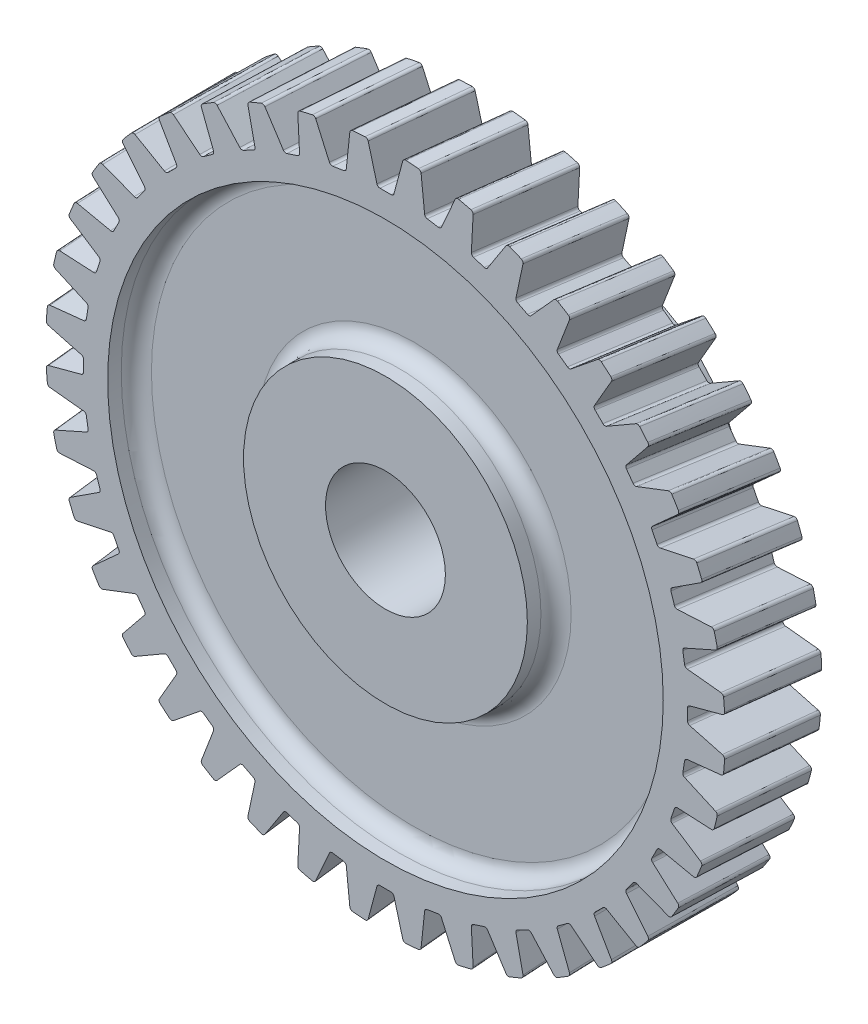
from build123d import *

# Parameters (mm, degrees)
FILLET1_R         = 1
CIRPATTERN1_COUNT = 40
FILLET2_R         = 0.2


with BuildPart() as part:
    # Sketch2 → Revolve1 (revolve)
    with BuildSketch(Plane(origin=(0, 0, 0), x_dir=(0, 0, -1), z_dir=(1, 0, 0))):
        Polygon((11, 3.96875), (-3.2, 3.96875), (-3.2, 9.4), (-1.3, 9.4), (-1.3, 18.4), (-3.2, 18.4), (-3.2, 22.5), (3.2, 22.5), (3.2, 18.4), (1.3, 18.4), (1.3, 9.4), (3.2, 9.4), (11, 9.4), align=None)
    revolve(axis=Axis((0, 0, 0), (0, 0, -1)))

    # Fillet1
    fillet1_edges = [part.edges().sort_by_distance(p)[0] for p in [
        (0, -18.4, 1.3),
        (0, -9.4, 1.3),
        (0, -9.4, -1.3),
        (0, -18.4, -1.3),
    ]]
    fillet(fillet1_edges, radius=FILLET1_R)

    # Cut-Sweep1: sweep along a path in Sketch4
    with BuildLine(Plane(origin=(0, 0, 0), x_dir=(1, 0, 0), z_dir=(0, 1, 0))) as cut_sweep1_path:
        Line((0, -3.2), (0.690971205, 3.2))
    # Sketch3 → Cut-Sweep1 (sweep, cut)
    with BuildSketch(Plane.XY.offset(3.2)):
        Polygon((-0.525, 20), (0.525, 20), (1.246362285, 22.6921607), (-1.246362285, 22.6921607), align=None)
    cut_sweep1 = sweep(path=cut_sweep1_path.line, mode=Mode.SUBTRACT)

    # CirPattern1: Cut-Sweep1 ×40 about axis
    cirpattern1_axis = Axis((0, 0, 3.2), (0, 0, 1))
    for i in range(1, CIRPATTERN1_COUNT):
        add(cut_sweep1.rotate(cirpattern1_axis, i * 360 / CIRPATTERN1_COUNT), mode=Mode.SUBTRACT)

    # Fillet2
    fillet2_edges = [part.edges().sort_by_distance(p)[0] for p in [
        (1.526462518, 22.448160552, 5.3054e-05),
        (0.870485603, 20, 0),
        (-0.845126217, 22.484122435, -6.2808e-05),
        (-2.003996756, 22.410577793, 5.3054e-05),
        (-2.26892082, 19.889940761, 0),
        (-3.305993578, 19.725684573, 0),
        (-4.352012976, 22.07509871, -6.2808e-05),
        (-5.485110979, 21.821172231, 5.3054e-05),
        (-5.352458883, 19.29012517, 0),
        (-6.351068225, 18.965657326, 0),
        (-7.751738732, 21.122512792, -6.2808e-05),
        (-8.831163565, 20.694456989, 5.3054e-05),
        (-8.304201644, 18.215322678, 0),
        (-9.239758494, 17.738632653, 0),
        (-10.960590953, 19.649820507, -6.2808e-05),
        (-11.959763596, 19.058175535, 5.3054e-05),
        (-11.0514674, 16.691998487, 0),
        (-11.900935244, 16.074823972, 0),
        (-13.89955705, 17.693284427, -6.2808e-05),
        (-14.793874554, 16.952618549, 5.3054e-05),
        (-13.526609351, 14.757661896, 0),
        (-14.269071471, 14.015199776, 0),
        (-16.496269922, 15.301080964, -6.2808e-05),
        (-17.263711223, 14.429631832, 5.3054e-05),
        (-15.668681288, 12.459942692, 0),
        (-16.285855803, 11.610474848, 0),
        (-18.68678988, 12.532114106, -6.2808e-05),
        (-19.308458027, 11.55133969, 5.3054e-05),
        (-17.42493829, 9.855418346, 0),
        (-17.901628315, 8.919861496, 0),
        (-20.417179054, 9.454565008, -6.2808e-05),
        (-20.877766513, 8.388615227, 5.3054e-05),
        (-18.752135481, 7.008220892, 0),
        (-19.076603325, 6.00961155, 0),
        (-21.644829518, 6.144213141, -6.2808e-05),
        (-21.932995098, 5.019335218, 5.3054e-05),
        (-19.617592862, 3.988457781, 0),
        (-19.781849051, 2.951385024, 0),
        (-22.339512445, 2.682570354, -6.2808e-05),
        (-22.448160552, 1.526462518, 5.3054e-05),
        (-20, 0.870485603, 0),
        (-20, -0.179514397, 0),
        (-22.484122435, -0.845126217, -6.2808e-05),
        (-22.410577793, -2.003996756, 5.3054e-05),
        (-19.889940761, -2.26892082, 0),
        (-19.725684573, -3.305993578, 0),
        (-22.07509871, -4.352012976, -6.2808e-05),
        (-21.821172231, -5.485110979, 5.3054e-05),
        (-19.29012517, -5.352458883, 0),
        (-18.965657326, -6.351068225, 0),
        (-21.122512792, -7.751738732, -6.2808e-05),
        (-20.694456989, -8.831163565, 5.3054e-05),
        (-18.215322678, -8.304201644, 0),
        (-17.738632653, -9.239758494, 0),
        (-19.649820507, -10.960590953, -6.2808e-05),
        (-19.058175535, -11.959763596, 5.3054e-05),
        (-16.691998487, -11.0514674, 0),
        (-16.074823972, -11.900935244, 0),
        (-17.693284427, -13.89955705, -6.2808e-05),
        (-16.952618549, -14.793874554, 5.3054e-05),
        (-14.757661896, -13.526609351, 0),
        (-14.015199776, -14.269071471, 0),
        (-15.301080964, -16.496269922, -6.2808e-05),
        (-14.429631832, -17.263711223, 5.3054e-05),
        (-12.459942692, -15.668681288, 0),
        (-11.610474848, -16.285855803, 0),
        (-12.532114106, -18.68678988, -6.2808e-05),
        (-11.55133969, -19.308458027, 5.3054e-05),
        (-9.855418346, -17.42493829, 0),
        (-8.919861496, -17.901628315, 0),
        (-9.454565008, -20.417179054, -6.2808e-05),
        (-8.388615227, -20.877766513, 5.3054e-05),
        (-7.008220892, -18.752135481, 0),
        (-6.00961155, -19.076603325, 0),
        (-6.144213141, -21.644829518, -6.2808e-05),
        (-5.019335218, -21.932995098, 5.3054e-05),
        (-3.988457781, -19.617592862, 0),
        (-2.951385024, -19.781849051, 0),
        (-2.682570354, -22.339512445, -6.2808e-05),
        (-1.526462518, -22.448160552, 5.3054e-05),
        (-0.870485603, -20, 0),
        (0.179514397, -20, 0),
        (0.845126217, -22.484122435, -6.2808e-05),
        (2.003996756, -22.410577793, 5.3054e-05),
        (2.26892082, -19.889940761, 0),
        (3.305993578, -19.725684573, 0),
        (4.352012976, -22.07509871, -6.2808e-05),
        (5.485110979, -21.821172231, 5.3054e-05),
        (5.352458883, -19.29012517, 0),
        (6.351068225, -18.965657326, 0),
        (7.751738732, -21.122512792, -6.2808e-05),
        (8.831163565, -20.694456989, 5.3054e-05),
        (8.304201644, -18.215322678, 0),
        (9.239758494, -17.738632653, 0),
        (10.960590953, -19.649820507, -6.2808e-05),
        (11.959763596, -19.058175535, 5.3054e-05),
        (11.0514674, -16.691998487, 0),
        (11.900935244, -16.074823972, 0),
        (13.89955705, -17.693284427, -6.2808e-05),
        (14.793874554, -16.952618549, 5.3054e-05),
        (13.526609351, -14.757661896, 0),
        (14.269071471, -14.015199776, 0),
        (16.496269922, -15.301080964, -6.2808e-05),
        (17.263711223, -14.429631832, 5.3054e-05),
        (15.668681288, -12.459942692, 0),
        (16.285855803, -11.610474848, 0),
        (18.68678988, -12.532114106, -6.2808e-05),
        (19.308458027, -11.55133969, 5.3054e-05),
        (17.42493829, -9.855418346, 0),
        (17.901628315, -8.919861496, 0),
        (20.417179054, -9.454565008, -6.2808e-05),
        (20.877766513, -8.388615227, 5.3054e-05),
        (18.752135481, -7.008220892, 0),
        (19.076603325, -6.00961155, 0),
        (21.644829518, -6.144213141, -6.2808e-05),
        (21.932995098, -5.019335218, 5.3054e-05),
        (19.617592862, -3.988457781, 0),
        (19.781849051, -2.951385024, 0),
        (22.339512445, -2.682570354, -6.2808e-05),
        (22.448160552, -1.526462518, 5.3054e-05),
        (20, -0.870485603, 0),
        (20, 0.179514397, 0),
        (22.484122435, 0.845126217, -6.2808e-05),
        (22.410577793, 2.003996756, 5.3054e-05),
        (19.889940761, 2.26892082, 0),
        (19.725684573, 3.305993578, 0),
        (22.07509871, 4.352012976, -6.2808e-05),
        (21.821172231, 5.485110979, 5.3054e-05),
        (19.29012517, 5.352458883, 0),
        (18.965657326, 6.351068225, 0),
        (21.122512792, 7.751738732, -6.2808e-05),
        (20.694456989, 8.831163565, 5.3054e-05),
        (18.215322678, 8.304201644, 0),
        (17.738632653, 9.239758494, 0),
        (19.649820507, 10.960590953, -6.2808e-05),
        (19.058175535, 11.959763596, 5.3054e-05),
        (16.691998487, 11.0514674, 0),
        (16.074823972, 11.900935244, 0),
        (17.693284427, 13.89955705, -6.2808e-05),
        (16.952618549, 14.793874554, 5.3054e-05),
        (14.757661896, 13.526609351, 0),
        (14.015199776, 14.269071471, 0),
        (15.301080964, 16.496269922, -6.2808e-05),
        (14.429631832, 17.263711223, 5.3054e-05),
        (12.459942692, 15.668681288, 0),
        (11.610474848, 16.285855803, 0),
        (12.532114106, 18.68678988, -6.2808e-05),
        (11.55133969, 19.308458027, 5.3054e-05),
        (9.855418346, 17.42493829, 0),
        (8.919861496, 17.901628315, 0),
        (9.454565008, 20.417179054, -6.2808e-05),
        (8.388615227, 20.877766513, 5.3054e-05),
        (7.008220892, 18.752135481, 0),
        (6.00961155, 19.076603325, 0),
        (6.144213141, 21.644829518, -6.2808e-05),
        (5.019335218, 21.932995098, 5.3054e-05),
        (3.988457781, 19.617592862, 0),
        (2.951385024, 19.781849051, 0),
        (2.682570354, 22.339512445, -6.2808e-05),
        (-0.179514397, 20, 0),
    ]]
    fillet(fillet2_edges, radius=FILLET2_R)


solid = part.part
